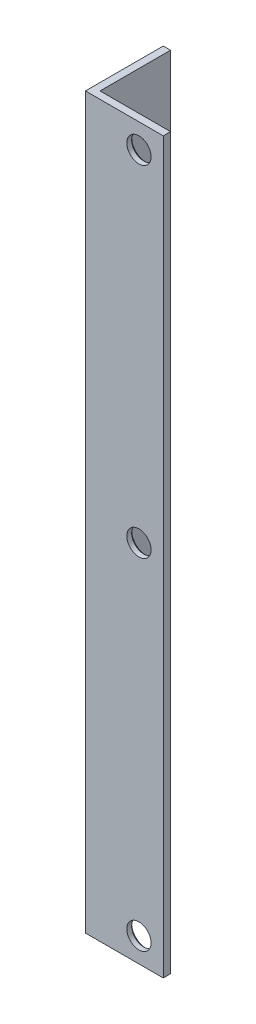
from build123d import *

# Parameters (mm, degrees)
EXTRUDE_1_DEPTH     = 300
SKETCH_2_R          = 5
CUT_EXTRUDE_1_DEPTH = 304.394133101
CHAMFER_1_SIZE      = 1


with BuildPart() as part:
    # Эскиз1 → Вытянуть-Тонкостенный1 (new body)
    with BuildSketch(Plane(origin=(0, 0, 0), x_dir=(1, 0, 0), z_dir=(0, 1, 0))):
        Polygon((0, 32), (0, 0), (32, 0), (32, 3), (3, 3), (3, 32), align=None)
    extrude(amount=EXTRUDE_1_DEPTH)

    # Эскиз2 → Вырез-Вытянуть1 (cut, through all)
    with BuildSketch(Plane.XY):
        with Locations((22, 10)):
            Circle(SKETCH_2_R)
        with Locations((22, 150)):
            Circle(SKETCH_2_R)
        with Locations((22, 290)):
            Circle(SKETCH_2_R)
    extrude(amount=-CUT_EXTRUDE_1_DEPTH, mode=Mode.SUBTRACT)

    # Фаска1
    chamfer_1_edges = [part.edges().sort_by_distance(p)[0] for p in [
        (17, 10, -3),
        (17, 150, -3),
        (17, 290, -3),
    ]]
    chamfer(chamfer_1_edges, length=CHAMFER_1_SIZE)


solid = part.part
